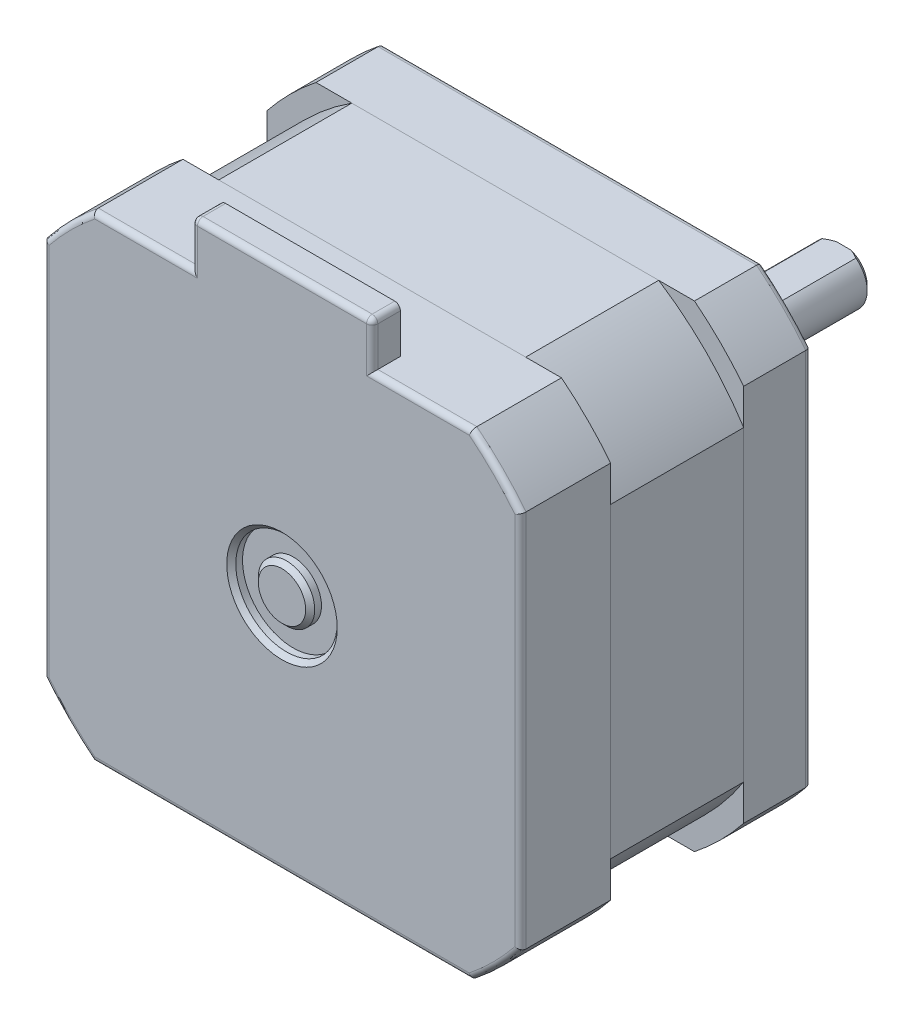
from build123d import *

# Parameters (mm, degrees)
BOSS_EXTRU_1_DEPTH           = 6
BOSS_EXTRU_2_DEPTH           = 11.8
BOSS_EXTRU_3_DEPTH           = 8
ESQUISSE4_W                  = 16
ESQUISSE4_H                  = 2.5
BOSS_EXTRU_4_DEPTH           = 4
ESQUISSE5_W                  = 2
ESQUISSE5_H                  = 6.5
ESQUISSE5_W_2                = 24
ESQUISSE5_H_2                = 2.5
CONG_1_R                     = 0.5
CONG_2_R                     = 0.5
CHANFREIN1_SIZE              = 0.4
CHANFREIN2_SIZE              = 0.4
ENL_V_MAT_EXTRU_1_DEPTH      = 42.779002015
ENL_V_MAT_EXTRU_1_DEPTH_BACK = 42.779002015
ESQUISSE6_W                  = 15
ESQUISSE6_H                  = 0.5
ESQUISSE7_R                  = 4.5
ESQUISSE7_R_2                = 2.5
ENL_V_MAT_EXTRU_2_DEPTH      = 1
CHANFREIN3_SIZE              = 0.4
TROU_TARAUD_M31_AT_2_COUNT   = 2
TROU_TARAUD_M31_AT_2_PITCH   = 31
TROU_TARAUD_M31_AT_3_COUNT   = 2
TROU_TARAUD_M31_AT_3_PITCH   = 43.840620434
TROU_TARAUD_M31_AT_4_COUNT   = 2
TROU_TARAUD_M31_AT_4_PITCH   = 31


with BuildPart() as part:
    # Esquisse1 → Boss.-Extru.1 (new body)
    with BuildSketch(Plane.XY):
        with BuildLine():
            Line((21.15, 16.783250579), (21.15, -16.783250579))
            ThreePointArc((21.15, -16.783250579), (19.091883092, -19.091883092), (16.783250579, -21.15))
            Line((16.783250579, -21.15), (-16.783250579, -21.15))
            ThreePointArc((-16.783250579, -21.15), (-19.091883092, -19.091883092), (-21.15, -16.783250579))
            Line((-21.15, -16.783250579), (-21.15, 16.783250579))
            ThreePointArc((-21.15, 16.783250579), (-19.091883092, 19.091883092), (-16.783250579, 21.15))
            Line((-16.783250579, 21.15), (16.783250579, 21.15))
            ThreePointArc((16.783250579, 21.15), (19.091883092, 19.091883092), (21.15, 16.783250579))
        make_face()
    extrude(amount=BOSS_EXTRU_1_DEPTH)

    # Congé2
    cong_2_edges = [part.edges().sort_by_distance(p)[0] for p in [
        (-19.091883092, 19.091883092, 0),
        (-21.15, 0, 0),
        (-19.091883092, -19.091883092, 0),
        (0, -21.15, 0),
        (19.091883092, -19.091883092, 0),
        (21.15, 0, 0),
        (0, 21.15, 0),
        (19.091883092, 19.091883092, 0),
    ]]
    fillet(cong_2_edges, radius=CONG_2_R)

    # Esquisse9 → Trou taraudé M31 (revolve, cut)
    with BuildSketch(Plane(origin=(15.5, -15.5, 0), x_dir=(0, 1, 0), z_dir=(1, 0, 0))):
        Polygon((0, 0), (0, 5.751075774), (1.25, 5), (1.25, 0), align=None)
    trou_taraud_m31 = revolve(axis=Axis((15.5, -15.5, -6.35), (0, 0, 1)), mode=Mode.SUBTRACT)

    # Trou taraudé M31 at 2: Trou taraudé M31 ×2
    with Locations(*[(0, i * TROU_TARAUD_M31_AT_2_PITCH, 0) for i in range(1, TROU_TARAUD_M31_AT_2_COUNT)]):
        add(trou_taraud_m31, mode=Mode.SUBTRACT)

    # Trou taraudé M31 at 3: Trou taraudé M31 ×2
    with Locations(*[Vector(-0.7071067811865476, 0.7071067811865476, 0) * (i * TROU_TARAUD_M31_AT_3_PITCH) for i in range(1, TROU_TARAUD_M31_AT_3_COUNT)]):
        add(trou_taraud_m31, mode=Mode.SUBTRACT)

    # Trou taraudé M31 at 4: Trou taraudé M31 ×2
    with Locations(*[(-i * TROU_TARAUD_M31_AT_4_PITCH, 0, 0) for i in range(1, TROU_TARAUD_M31_AT_4_COUNT)]):
        add(trou_taraud_m31, mode=Mode.SUBTRACT)


with BuildPart() as body_2:
    # Esquisse2 → Boss.-Extru.2 (new body)
    with BuildSketch(Plane.XY.offset(6)):
        with BuildLine():
            Line((-13.608820669, 21.15), (13.608820669, 21.15))
            ThreePointArc((13.608820669, 21.15), (17.783735547, 17.783735547), (21.15, 13.608820669))
            Line((21.15, 13.608820669), (21.15, -13.608820669))
            ThreePointArc((21.15, -13.608820669), (17.783735547, -17.783735547), (13.608820669, -21.15))
            Line((13.608820669, -21.15), (-13.608820669, -21.15))
            ThreePointArc((-13.608820669, -21.15), (-17.783735547, -17.783735547), (-21.15, -13.608820669))
            Line((-21.15, -13.608820669), (-21.15, 13.608820669))
            ThreePointArc((-21.15, 13.608820669), (-17.783735547, 17.783735547), (-13.608820669, 21.15))
        make_face()
    extrude(amount=BOSS_EXTRU_2_DEPTH)


with BuildPart() as body_3:
    # Esquisse3 → Boss.-Extru.3 (new body)
    with BuildSketch(Plane.XY.offset(17.8)):
        with BuildLine():
            Line((-16.783250579, -21.15), (16.783250579, -21.15))
            ThreePointArc((16.783250579, -21.15), (19.091883092, -19.091883092), (21.15, -16.783250579))
            Line((21.15, -16.783250579), (21.15, 16.783250579))
            ThreePointArc((21.15, 16.783250579), (19.091883092, 19.091883092), (16.783250579, 21.15))
            Line((16.783250579, 21.15), (-16.783250579, 21.15))
            ThreePointArc((-16.783250579, 21.15), (-19.091883092, 19.091883092), (-21.15, 16.783250579))
            Line((-21.15, 16.783250579), (-21.15, -16.783250579))
            ThreePointArc((-21.15, -16.783250579), (-19.091883092, -19.091883092), (-16.783250579, -21.15))
        make_face()
    extrude(amount=BOSS_EXTRU_3_DEPTH)

    # Esquisse4 → Boss.-Extru.4 (add)
    with BuildSketch(Plane(origin=(0, 21.15, 0), x_dir=(1, 0, 0), z_dir=(0, 1, 0))):
        with Locations((0, -24.55)):
            Rectangle(ESQUISSE4_W, ESQUISSE4_H)
    extrude(amount=BOSS_EXTRU_4_DEPTH)

    # Congé1
    cong_1_edges = [body_3.edges().sort_by_distance(p)[0] for p in [
        (-21.15, 0, 25.8),
        (-19.091883092, 19.091883092, 25.8),
        (-12.39162529, 21.15, 25.8),
        (-8, 23.15, 25.8),
        (0, 25.15, 25.8),
        (8, 23.15, 25.8),
        (12.39162529, 21.15, 25.8),
        (19.091883092, 19.091883092, 25.8),
        (21.15, 0, 25.8),
        (19.091883092, -19.091883092, 25.8),
        (0, -21.15, 25.8),
        (-19.091883092, -19.091883092, 25.8),
        (-8, 25.15, 24.55),
        (8, 25.15, 24.55),
    ]]
    fillet(cong_1_edges, radius=CONG_1_R)

    # Esquisse7 → Enlèv. mat.-Extru.2 (cut)
    with BuildSketch(Plane.XY.offset(25.8)):
        Circle(ESQUISSE7_R)
        Circle(ESQUISSE7_R_2, mode=Mode.SUBTRACT)
    extrude(amount=-ENL_V_MAT_EXTRU_2_DEPTH, mode=Mode.SUBTRACT)

    # Chanfrein3
    chanfrein3_edges = [body_3.edges().sort_by_distance(p)[0] for p in [
        (-4.5, 0, 25.8),
        (-2.5, 0, 25.8),
    ]]
    chamfer(chanfrein3_edges, length=CHANFREIN3_SIZE)


with BuildPart() as body_4:
    # Esquisse5 → Révolution1 (revolve)
    with BuildSketch(Plane(origin=(0, 0, 0), x_dir=(0, 0, -1), z_dir=(1, 0, 0))):
        with Locations((1, 7.75)):
            Rectangle(ESQUISSE5_W, ESQUISSE5_H)
        with Locations((12, 1.25)):
            Rectangle(ESQUISSE5_W_2, ESQUISSE5_H_2)
    revolve(axis=Axis((0, 0, 0), (0, 0, 1)))

    # Chanfrein1
    chanfrein1_edges = [body_4.edges().sort_by_distance(p)[0] for p in [
        (0, -2.5, -24),
    ]]
    chamfer(chanfrein1_edges, length=CHANFREIN1_SIZE)

    # Chanfrein2
    chanfrein2_edges = [body_4.edges().sort_by_distance(p)[0] for p in [
        (0, -4.5, -2),
        (0, -11, -2),
    ]]
    chamfer(chanfrein2_edges, length=CHANFREIN2_SIZE)

    # Esquisse6 → Enlèv. mat.-Extru.1 (cut, two sides: drawn at the far end of the back side and taken through both)
    with BuildSketch(Plane(origin=(0, 0, 0), x_dir=(0, 0, -1), z_dir=(1, 0, 0)).offset(-ENL_V_MAT_EXTRU_1_DEPTH_BACK)):
        with Locations((16.5, 2.25)):
            Rectangle(ESQUISSE6_W, ESQUISSE6_H)
    extrude(amount=ENL_V_MAT_EXTRU_1_DEPTH + ENL_V_MAT_EXTRU_1_DEPTH_BACK, mode=Mode.SUBTRACT)


solid = Compound([part.part, body_2.part, body_3.part, body_4.part])
